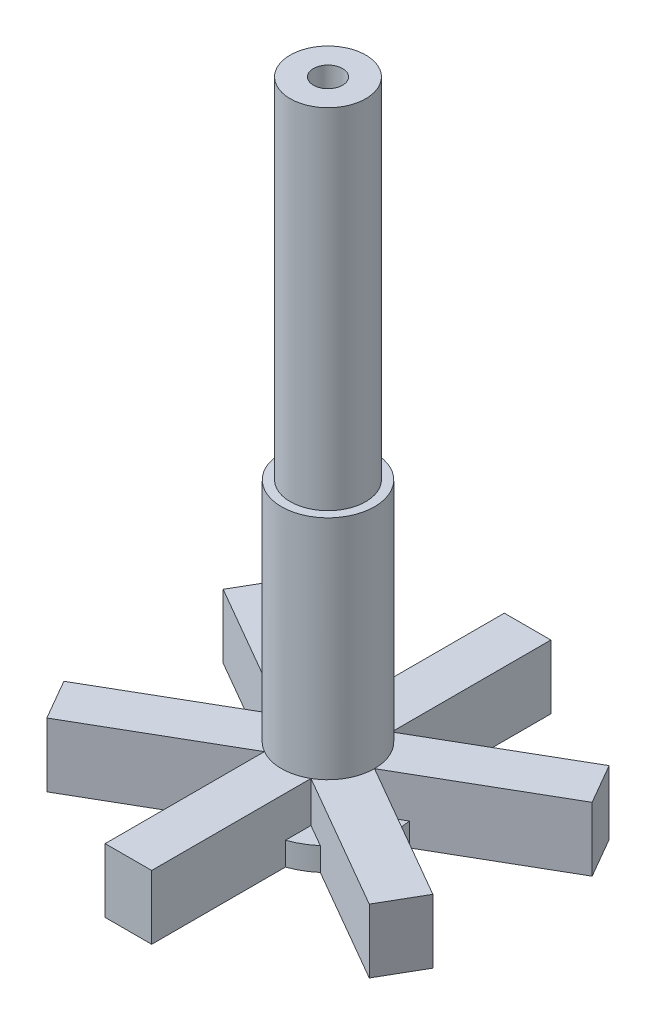
from build123d import *

# Parameters (mm, degrees)
BOSS_EXTRUDE1_DEPTH = 25
SKETCH1_4_R         = 4
BOSS_EXTRUDE3_DEPTH = 2
BOSS_EXTRUDE2_DEPTH = 5.5
SKETCH2_R           = 3.25
BOSS_EXTRUDE6_DEPTH = 30
SKETCH3_R           = 1.25
CUT_EXTRUDE1_DEPTH  = 10


with BuildPart() as part:
    # Sketch1 → Boss-Extrude1 (new body)
    with BuildSketch(Plane(origin=(0, 0, 0), x_dir=(1, 0, 0), z_dir=(0, 1, 0))):
        with BuildLine():
            ThreePointArc((-4, 0), (-3.464101615, -2), (-2, -3.464101615))
            ThreePointArc((-2, -3.464101615), (0, -4), (2, -3.464101615))
            ThreePointArc((2, -3.464101615), (3.464101615, -2), (4, 0))
            ThreePointArc((4, 0), (3.464101615, 2), (2, 3.464101615))
            ThreePointArc((2, 3.464101615), (0, 4), (-2, 3.464101615))
            ThreePointArc((-2, 3.464101615), (-3.464101615, 2), (-4, 0))
        make_face()
    extrude(amount=BOSS_EXTRUDE1_DEPTH)

    # Sketch1<4> → Boss-Extrude3 (add)
    with BuildSketch(Plane(origin=(0, 0, 0), x_dir=(1, 0, 0), z_dir=(0, 1, 0))):
        with BuildLine():
            Line((-2, -5.656854249), (2, -5.656854249))
            ThreePointArc((2, -5.656854249), (3, -5.196152423), (3.898979486, -4.560477932))
            Line((3.898979486, -4.560477932), (5.898979486, -1.096376317))
            ThreePointArc((5.898979486, -1.096376317), (6, 0), (5.898979486, 1.096376317))
            Line((5.898979486, 1.096376317), (3.898979486, 4.560477932))
            ThreePointArc((3.898979486, 4.560477932), (3, 5.196152423), (2, 5.656854249))
            Line((2, 5.656854249), (-2, 5.656854249))
            ThreePointArc((-2, 5.656854249), (-3, 5.196152423), (-3.898979486, 4.560477932))
            Line((-3.898979486, 4.560477932), (-5.898979486, 1.096376317))
            ThreePointArc((-5.898979486, 1.096376317), (-6, 0), (-5.898979486, -1.096376317))
            Line((-5.898979486, -1.096376317), (-3.898979486, -4.560477932))
            ThreePointArc((-3.898979486, -4.560477932), (-3, -5.196152423), (-2, -5.656854249))
        make_face()
        Circle(SKETCH1_4_R, mode=Mode.SUBTRACT)
    extrude(amount=BOSS_EXTRUDE3_DEPTH)

    # Sketch1<3> → Boss-Extrude2 (add)
    with BuildSketch(Plane(origin=(0, 0, 0), x_dir=(1, 0, 0), z_dir=(0, 1, 0))):
        with BuildLine():
            Line((-2, -3.464101615), (-2, -17.156854249))
            Line((-2, -17.156854249), (2, -17.156854249))
            Line((2, -17.156854249), (2, -3.464101615))
            ThreePointArc((2, -3.464101615), (0, -4), (-2, -3.464101615))
        make_face()
        with BuildLine():
            ThreePointArc((-2, -3.464101615), (-3.464101615, -2), (-4, 0))
            Line((-4, 0), (-15.858271629, -6.846376317))
            Line((-15.858271629, -6.846376317), (-13.858271629, -10.310477932))
            Line((-13.858271629, -10.310477932), (-2, -3.464101615))
        make_face()
        with BuildLine():
            ThreePointArc((4, 0), (3.464101615, -2), (2, -3.464101615))
            Line((2, -3.464101615), (13.858271629, -10.310477932))
            Line((13.858271629, -10.310477932), (15.858271629, -6.846376317))
            Line((15.858271629, -6.846376317), (4, 0))
        make_face()
        with BuildLine():
            ThreePointArc((-4, 0), (-3.464101615, 2), (-2, 3.464101615))
            Line((-2, 3.464101615), (-13.858271629, 10.310477932))
            Line((-13.858271629, 10.310477932), (-15.858271629, 6.846376317))
            Line((-15.858271629, 6.846376317), (-4, 0))
        make_face()
        with BuildLine():
            ThreePointArc((2, 3.464101615), (3.464101615, 2), (4, 0))
            Line((4, 0), (15.858271629, 6.846376317))
            Line((15.858271629, 6.846376317), (13.858271629, 10.310477932))
            Line((13.858271629, 10.310477932), (2, 3.464101615))
        make_face()
        with BuildLine():
            ThreePointArc((-2, 3.464101615), (0, 4), (2, 3.464101615))
            Line((2, 3.464101615), (2, 17.156854249))
            Line((2, 17.156854249), (-2, 17.156854249))
            Line((-2, 17.156854249), (-2, 3.464101615))
        make_face()
    extrude(amount=BOSS_EXTRUDE2_DEPTH)

    # Sketch2 → Boss-Extrude6 (add)
    with BuildSketch(Plane(origin=(0, 25, 0), x_dir=(1, 0, 0), z_dir=(0, 1, 0))):
        Circle(SKETCH2_R)
    extrude(amount=BOSS_EXTRUDE6_DEPTH)

    # Sketch3 → Cut-Extrude1 (cut)
    with BuildSketch(Plane(origin=(0, 55, 0), x_dir=(1, 0, 0), z_dir=(0, 1, 0))):
        Circle(SKETCH3_R)
    extrude(amount=-CUT_EXTRUDE1_DEPTH, mode=Mode.SUBTRACT)


solid = part.part
